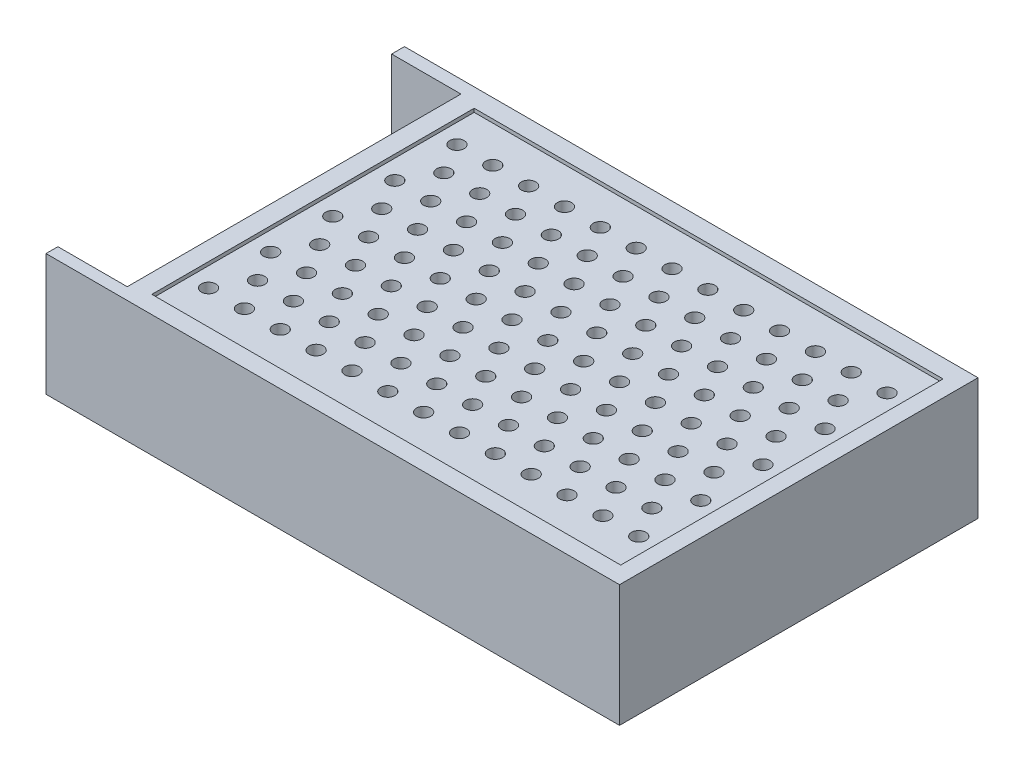
from build123d import *

# Parameters (mm, degrees)
ESBO_O1_W                          = 160
ESBO_O1_H                          = 100
RESSALTO_EXTRUS_O1_DEPTH           = 33
ESBO_O2_W                          = 19.343626511
ESBO_O2_H                          = 93.094347137
CORTE_EXTRUS_O1_DEPTH              = 20
ESBO_O3_W                          = 130.806788046
ESBO_O3_H                          = 89.929666781
CORTE_EXTRUS_O2_DEPTH              = 1
ESBO_O4_R                          = 2
CORTE_EXTRUS_O3_DEPTH              = 100.619275243
PADR_O_DE_PREENCHIMENTO1_OUTLINE_R = 2
PADR_O_DE_PREENCHIMENTO1_DEPTH     = 32
ESBO_O5_W                          = 160
ESBO_O5_H                          = 100
ESBO_O5_R                          = 1.5
RESSALTO_EXTRUS_O2_DEPTH           = 1


# Read off the part's stored shape, not the designer's step: Padrão de preenchimento1
with BuildPart() as part:
    # Esboço1 → Ressalto-extrusão1 (new body)
    with BuildSketch(Plane(origin=(0, 0, 0), x_dir=(1, 0, 0), z_dir=(0, 1, 0))):
        Rectangle(ESBO_O1_W, ESBO_O1_H)
    extrude(amount=RESSALTO_EXTRUS_O1_DEPTH)

    # Esboço2 → Corte-extrusão1 (cut)
    with BuildSketch(Plane(origin=(0, 33, 0), x_dir=(1, 0, 0), z_dir=(0, 1, 0))):
        with Locations((-70.328186745, -0.131861682)):
            Rectangle(ESBO_O2_W, ESBO_O2_H)
    extrude(amount=-CORTE_EXTRUS_O1_DEPTH, mode=Mode.SUBTRACT)

    # Esboço3 → Corte-extrusão2 (cut)
    with BuildSketch(Plane(origin=(0, 33, 0), x_dir=(1, 0, 0), z_dir=(0, 1, 0))):
        with Locations((10.021487794, -0.131861681)):
            Rectangle(ESBO_O3_W, ESBO_O3_H)
    extrude(amount=-CORTE_EXTRUS_O2_DEPTH, mode=Mode.SUBTRACT)

    # Esboço4 → Corte-extrusão3 (cut, through all)
    with BuildSketch(Plane(origin=(0, 32, 0), x_dir=(1, 0, 0), z_dir=(0, 1, 0))):
        with Locations(Location((0, 0, 0), (0, 0, 270))):
            Circle(ESBO_O4_R)
    extrude(amount=-CORTE_EXTRUS_O3_DEPTH, mode=Mode.SUBTRACT)

    # Padrão de preenchimento1 outline → Padrão de preenchimento1 (cut)
    with BuildSketch(Plane(origin=(0, 0, 0), x_dir=(1, 0, 0), z_dir=(0, 1, 0))):
        with Locations((-50, 34.641016151)):
            Circle(PADR_O_DE_PREENCHIMENTO1_OUTLINE_R)
        with Locations((-50, 17.320508076)):
            Circle(PADR_O_DE_PREENCHIMENTO1_OUTLINE_R)
        with Locations((-45, 25.980762114)):
            Circle(PADR_O_DE_PREENCHIMENTO1_OUTLINE_R)
        with Locations((-40, 34.641016151)):
            Circle(PADR_O_DE_PREENCHIMENTO1_OUTLINE_R)
        with Locations((-50, 0)):
            Circle(PADR_O_DE_PREENCHIMENTO1_OUTLINE_R)
        with Locations((-45, 8.660254038)):
            Circle(PADR_O_DE_PREENCHIMENTO1_OUTLINE_R)
        with Locations((-40, 17.320508076)):
            Circle(PADR_O_DE_PREENCHIMENTO1_OUTLINE_R)
        with Locations((-35, 25.980762114)):
            Circle(PADR_O_DE_PREENCHIMENTO1_OUTLINE_R)
        with Locations((-30, 34.641016151)):
            Circle(PADR_O_DE_PREENCHIMENTO1_OUTLINE_R)
        with Locations((-50, -17.320508076)):
            Circle(PADR_O_DE_PREENCHIMENTO1_OUTLINE_R)
        with Locations((-45, -8.660254038)):
            Circle(PADR_O_DE_PREENCHIMENTO1_OUTLINE_R)
        with Locations((-40, 0)):
            Circle(PADR_O_DE_PREENCHIMENTO1_OUTLINE_R)
        with Locations((-35, 8.660254038)):
            Circle(PADR_O_DE_PREENCHIMENTO1_OUTLINE_R)
        with Locations((-30, 17.320508076)):
            Circle(PADR_O_DE_PREENCHIMENTO1_OUTLINE_R)
        with Locations((-25, 25.980762114)):
            Circle(PADR_O_DE_PREENCHIMENTO1_OUTLINE_R)
        with Locations((-20, 34.641016151)):
            Circle(PADR_O_DE_PREENCHIMENTO1_OUTLINE_R)
        with Locations((-50, -34.641016151)):
            Circle(PADR_O_DE_PREENCHIMENTO1_OUTLINE_R)
        with Locations((-45, -25.980762114)):
            Circle(PADR_O_DE_PREENCHIMENTO1_OUTLINE_R)
        with Locations((-40, -17.320508076)):
            Circle(PADR_O_DE_PREENCHIMENTO1_OUTLINE_R)
        with Locations((-35, -8.660254038)):
            Circle(PADR_O_DE_PREENCHIMENTO1_OUTLINE_R)
        with Locations((-30, 0)):
            Circle(PADR_O_DE_PREENCHIMENTO1_OUTLINE_R)
        with Locations((-25, 8.660254038)):
            Circle(PADR_O_DE_PREENCHIMENTO1_OUTLINE_R)
        with Locations((-20, 17.320508076)):
            Circle(PADR_O_DE_PREENCHIMENTO1_OUTLINE_R)
        with Locations((-15, 25.980762114)):
            Circle(PADR_O_DE_PREENCHIMENTO1_OUTLINE_R)
        with Locations((-10, 34.641016151)):
            Circle(PADR_O_DE_PREENCHIMENTO1_OUTLINE_R)
        with Locations((-40, -34.641016151)):
            Circle(PADR_O_DE_PREENCHIMENTO1_OUTLINE_R)
        with Locations((-35, -25.980762114)):
            Circle(PADR_O_DE_PREENCHIMENTO1_OUTLINE_R)
        with Locations((-30, -17.320508076)):
            Circle(PADR_O_DE_PREENCHIMENTO1_OUTLINE_R)
        with Locations((-25, -8.660254038)):
            Circle(PADR_O_DE_PREENCHIMENTO1_OUTLINE_R)
        with Locations((-20, 0)):
            Circle(PADR_O_DE_PREENCHIMENTO1_OUTLINE_R)
        with Locations((-15, 8.660254038)):
            Circle(PADR_O_DE_PREENCHIMENTO1_OUTLINE_R)
        with Locations((-10, 17.320508076)):
            Circle(PADR_O_DE_PREENCHIMENTO1_OUTLINE_R)
        with Locations((-5, 25.980762114)):
            Circle(PADR_O_DE_PREENCHIMENTO1_OUTLINE_R)
        with Locations((0, 34.641016151)):
            Circle(PADR_O_DE_PREENCHIMENTO1_OUTLINE_R)
        with Locations((-30, -34.641016151)):
            Circle(PADR_O_DE_PREENCHIMENTO1_OUTLINE_R)
        with Locations((-25, -25.980762114)):
            Circle(PADR_O_DE_PREENCHIMENTO1_OUTLINE_R)
        with Locations((-20, -17.320508076)):
            Circle(PADR_O_DE_PREENCHIMENTO1_OUTLINE_R)
        with Locations((-15, -8.660254038)):
            Circle(PADR_O_DE_PREENCHIMENTO1_OUTLINE_R)
        with Locations((-10, 0)):
            Circle(PADR_O_DE_PREENCHIMENTO1_OUTLINE_R)
        with Locations((-5, 8.660254038)):
            Circle(PADR_O_DE_PREENCHIMENTO1_OUTLINE_R)
        with Locations((0, 17.320508076)):
            Circle(PADR_O_DE_PREENCHIMENTO1_OUTLINE_R)
        with Locations((5, 25.980762114)):
            Circle(PADR_O_DE_PREENCHIMENTO1_OUTLINE_R)
        with Locations((10, 34.641016151)):
            Circle(PADR_O_DE_PREENCHIMENTO1_OUTLINE_R)
        with Locations((-20, -34.641016151)):
            Circle(PADR_O_DE_PREENCHIMENTO1_OUTLINE_R)
        with Locations((-15, -25.980762114)):
            Circle(PADR_O_DE_PREENCHIMENTO1_OUTLINE_R)
        with Locations((-10, -17.320508076)):
            Circle(PADR_O_DE_PREENCHIMENTO1_OUTLINE_R)
        with Locations((-5, -8.660254038)):
            Circle(PADR_O_DE_PREENCHIMENTO1_OUTLINE_R)
        with Locations((5, 8.660254038)):
            Circle(PADR_O_DE_PREENCHIMENTO1_OUTLINE_R)
        with Locations((10, 17.320508076)):
            Circle(PADR_O_DE_PREENCHIMENTO1_OUTLINE_R)
        with Locations((15, 25.980762114)):
            Circle(PADR_O_DE_PREENCHIMENTO1_OUTLINE_R)
        with Locations((20, 34.641016151)):
            Circle(PADR_O_DE_PREENCHIMENTO1_OUTLINE_R)
        with Locations((-10, -34.641016151)):
            Circle(PADR_O_DE_PREENCHIMENTO1_OUTLINE_R)
        with Locations((-5, -25.980762114)):
            Circle(PADR_O_DE_PREENCHIMENTO1_OUTLINE_R)
        with Locations((0, -17.320508076)):
            Circle(PADR_O_DE_PREENCHIMENTO1_OUTLINE_R)
        with Locations((5, -8.660254038)):
            Circle(PADR_O_DE_PREENCHIMENTO1_OUTLINE_R)
        with Locations((10, 0)):
            Circle(PADR_O_DE_PREENCHIMENTO1_OUTLINE_R)
        with Locations((15, 8.660254038)):
            Circle(PADR_O_DE_PREENCHIMENTO1_OUTLINE_R)
        with Locations((20, 17.320508076)):
            Circle(PADR_O_DE_PREENCHIMENTO1_OUTLINE_R)
        with Locations((25, 25.980762114)):
            Circle(PADR_O_DE_PREENCHIMENTO1_OUTLINE_R)
        with Locations((30, 34.641016151)):
            Circle(PADR_O_DE_PREENCHIMENTO1_OUTLINE_R)
        with Locations((0, -34.641016151)):
            Circle(PADR_O_DE_PREENCHIMENTO1_OUTLINE_R)
        with Locations((5, -25.980762114)):
            Circle(PADR_O_DE_PREENCHIMENTO1_OUTLINE_R)
        with Locations((10, -17.320508076)):
            Circle(PADR_O_DE_PREENCHIMENTO1_OUTLINE_R)
        with Locations((15, -8.660254038)):
            Circle(PADR_O_DE_PREENCHIMENTO1_OUTLINE_R)
        with Locations((20, 0)):
            Circle(PADR_O_DE_PREENCHIMENTO1_OUTLINE_R)
        with Locations((25, 8.660254038)):
            Circle(PADR_O_DE_PREENCHIMENTO1_OUTLINE_R)
        with Locations((30, 17.320508076)):
            Circle(PADR_O_DE_PREENCHIMENTO1_OUTLINE_R)
        with Locations((35, 25.980762114)):
            Circle(PADR_O_DE_PREENCHIMENTO1_OUTLINE_R)
        with Locations((40, 34.641016151)):
            Circle(PADR_O_DE_PREENCHIMENTO1_OUTLINE_R)
        with Locations((10, -34.641016151)):
            Circle(PADR_O_DE_PREENCHIMENTO1_OUTLINE_R)
        with Locations((15, -25.980762114)):
            Circle(PADR_O_DE_PREENCHIMENTO1_OUTLINE_R)
        with Locations((20, -17.320508076)):
            Circle(PADR_O_DE_PREENCHIMENTO1_OUTLINE_R)
        with Locations((25, -8.660254038)):
            Circle(PADR_O_DE_PREENCHIMENTO1_OUTLINE_R)
        with Locations((30, 0)):
            Circle(PADR_O_DE_PREENCHIMENTO1_OUTLINE_R)
        with Locations((35, 8.660254038)):
            Circle(PADR_O_DE_PREENCHIMENTO1_OUTLINE_R)
        with Locations((40, 17.320508076)):
            Circle(PADR_O_DE_PREENCHIMENTO1_OUTLINE_R)
        with Locations((45, 25.980762114)):
            Circle(PADR_O_DE_PREENCHIMENTO1_OUTLINE_R)
        with Locations((50, 34.641016151)):
            Circle(PADR_O_DE_PREENCHIMENTO1_OUTLINE_R)
        with Locations((20, -34.641016151)):
            Circle(PADR_O_DE_PREENCHIMENTO1_OUTLINE_R)
        with Locations((25, -25.980762114)):
            Circle(PADR_O_DE_PREENCHIMENTO1_OUTLINE_R)
        with Locations((30, -17.320508076)):
            Circle(PADR_O_DE_PREENCHIMENTO1_OUTLINE_R)
        with Locations((35, -8.660254038)):
            Circle(PADR_O_DE_PREENCHIMENTO1_OUTLINE_R)
        with Locations((40, 0)):
            Circle(PADR_O_DE_PREENCHIMENTO1_OUTLINE_R)
        with Locations((45, 8.660254038)):
            Circle(PADR_O_DE_PREENCHIMENTO1_OUTLINE_R)
        with Locations((50, 17.320508076)):
            Circle(PADR_O_DE_PREENCHIMENTO1_OUTLINE_R)
        with Locations((55, 25.980762114)):
            Circle(PADR_O_DE_PREENCHIMENTO1_OUTLINE_R)
        with Locations((60, 34.641016151)):
            Circle(PADR_O_DE_PREENCHIMENTO1_OUTLINE_R)
        with Locations((30, -34.641016151)):
            Circle(PADR_O_DE_PREENCHIMENTO1_OUTLINE_R)
        with Locations((35, -25.980762114)):
            Circle(PADR_O_DE_PREENCHIMENTO1_OUTLINE_R)
        with Locations((40, -17.320508076)):
            Circle(PADR_O_DE_PREENCHIMENTO1_OUTLINE_R)
        with Locations((45, -8.660254038)):
            Circle(PADR_O_DE_PREENCHIMENTO1_OUTLINE_R)
        with Locations((50, 0)):
            Circle(PADR_O_DE_PREENCHIMENTO1_OUTLINE_R)
        with Locations((55, 8.660254038)):
            Circle(PADR_O_DE_PREENCHIMENTO1_OUTLINE_R)
        with Locations((60, 17.320508076)):
            Circle(PADR_O_DE_PREENCHIMENTO1_OUTLINE_R)
        with Locations((65, 25.980762114)):
            Circle(PADR_O_DE_PREENCHIMENTO1_OUTLINE_R)
        with Locations((70, 34.641016151)):
            Circle(PADR_O_DE_PREENCHIMENTO1_OUTLINE_R)
        with Locations((40, -34.641016151)):
            Circle(PADR_O_DE_PREENCHIMENTO1_OUTLINE_R)
        with Locations((45, -25.980762114)):
            Circle(PADR_O_DE_PREENCHIMENTO1_OUTLINE_R)
        with Locations((50, -17.320508076)):
            Circle(PADR_O_DE_PREENCHIMENTO1_OUTLINE_R)
        with Locations((55, -8.660254038)):
            Circle(PADR_O_DE_PREENCHIMENTO1_OUTLINE_R)
        with Locations((60, 0)):
            Circle(PADR_O_DE_PREENCHIMENTO1_OUTLINE_R)
        with Locations((65, 8.660254038)):
            Circle(PADR_O_DE_PREENCHIMENTO1_OUTLINE_R)
        with Locations((70, 17.320508076)):
            Circle(PADR_O_DE_PREENCHIMENTO1_OUTLINE_R)
        with Locations((50, -34.641016151)):
            Circle(PADR_O_DE_PREENCHIMENTO1_OUTLINE_R)
        with Locations((55, -25.980762114)):
            Circle(PADR_O_DE_PREENCHIMENTO1_OUTLINE_R)
        with Locations((60, -17.320508076)):
            Circle(PADR_O_DE_PREENCHIMENTO1_OUTLINE_R)
        with Locations((65, -8.660254038)):
            Circle(PADR_O_DE_PREENCHIMENTO1_OUTLINE_R)
        with Locations((70, 0)):
            Circle(PADR_O_DE_PREENCHIMENTO1_OUTLINE_R)
        with Locations((60, -34.641016151)):
            Circle(PADR_O_DE_PREENCHIMENTO1_OUTLINE_R)
        with Locations((65, -25.980762114)):
            Circle(PADR_O_DE_PREENCHIMENTO1_OUTLINE_R)
        with Locations((70, -17.320508076)):
            Circle(PADR_O_DE_PREENCHIMENTO1_OUTLINE_R)
        with Locations((70, -34.641016151)):
            Circle(PADR_O_DE_PREENCHIMENTO1_OUTLINE_R)
    extrude(amount=PADR_O_DE_PREENCHIMENTO1_DEPTH, mode=Mode.SUBTRACT)

    # Esboço5 → Ressalto-extrusão2 (add)
    with BuildSketch(Plane.XZ):
        Rectangle(ESBO_O5_W, ESBO_O5_H)
        with Locations(Location((-56, 18, 0), (0, 0, 270))):
            Circle(ESBO_O5_R, mode=Mode.SUBTRACT)
        with Locations(Location((22.6, 18, 0), (0, 0, 147.388887539))):
            Circle(ESBO_O5_R, mode=Mode.SUBTRACT)
    extrude(amount=RESSALTO_EXTRUS_O2_DEPTH)


solid = part.part
